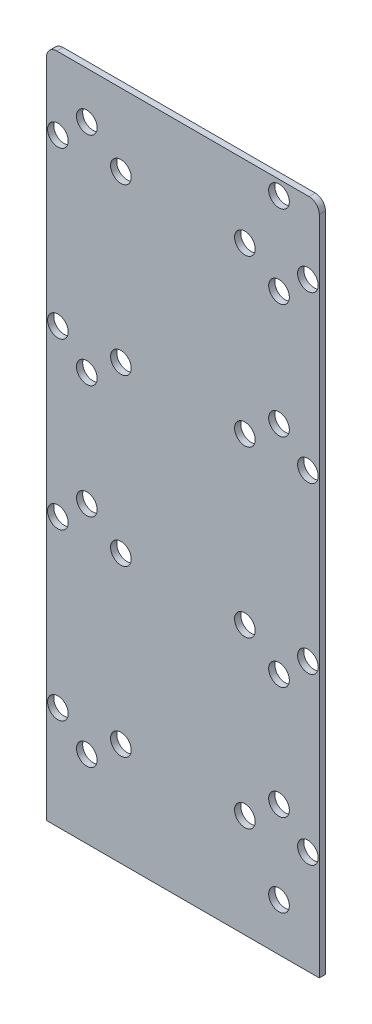
from build123d import *

# Parameters (mm, degrees)
SKETCH1_W           = 132
SKETCH1_H           = 325
BOSS_EXTRUDE1_DEPTH = 3
SKETCH2_R           = 5
CUT_EXTRUDE1_DEPTH  = 537.159285925
SKETCH3_R           = 5
CUT_EXTRUDE2_DEPTH  = 10
SKETCH4_R           = 5
CUT_EXTRUDE3_DEPTH  = 10
LPATTERN1_COUNT     = 4
LPATTERN1_PITCH     = 80
FILLET1_R           = 5


with BuildPart() as part:
    # Sketch1 → Boss-Extrude1 (new body)
    with BuildSketch(Plane.XY.offset(3)):
        with Locations((24.851179955, 365.89742901)):
            Rectangle(SKETCH1_W, SKETCH1_H)
    extrude(amount=-BOSS_EXTRUDE1_DEPTH)

    # Sketch2 → Cut-Extrude1 (cut, through all)
    with BuildSketch(Plane.XY.offset(3)):
        with Locations((71.351179955, 521.39742901)):
            Circle(SKETCH2_R)
        with Locations((71.351179955, 481.39742901)):
            Circle(SKETCH2_R)
        with Locations((71.351179955, 425.89742901)):
            Circle(SKETCH2_R)
        with Locations((71.351179955, 320.89742901)):
            Circle(SKETCH2_R)
        with Locations((71.351179955, 266.39742901)):
            Circle(SKETCH2_R)
        with Locations((71.351179955, 226.39742901)):
            Circle(SKETCH2_R)
    extrude(amount=-CUT_EXTRUDE1_DEPTH, mode=Mode.SUBTRACT)

    # Sketch3 → Cut-Extrude2 (cut)
    with BuildSketch(Plane.XY.offset(3)):
        with Locations((-21.648820045, 505.89742901)):
            Circle(SKETCH3_R)
        with Locations((-21.648820045, 400.89742901)):
            Circle(SKETCH3_R)
        with Locations((-21.648820045, 345.89742901)):
            Circle(SKETCH3_R)
        with Locations((-21.648820045, 240.89742901)):
            Circle(SKETCH3_R)
    extrude(amount=-CUT_EXTRUDE2_DEPTH, mode=Mode.SUBTRACT)

    # Sketch4 → Cut-Extrude3 (cut)
    with BuildSketch(Plane.XY.offset(3)):
        with Locations((-35.648820045, 253.39742901)):
            Circle(SKETCH4_R)
        with Locations((-5.148820045, 253.39742901)):
            Circle(SKETCH4_R)
        with Locations((54.851179955, 253.39742901)):
            Circle(SKETCH4_R)
        with Locations((85.351179955, 253.39742901)):
            Circle(SKETCH4_R)
    cut_extrude3 = extrude(amount=-CUT_EXTRUDE3_DEPTH, mode=Mode.SUBTRACT)

    # LPattern1: Cut-Extrude3 ×4
    with Locations(*[(0, i * LPATTERN1_PITCH, 0) for i in range(1, LPATTERN1_COUNT)]):
        add(cut_extrude3, mode=Mode.SUBTRACT)

    # Fillet1
    fillet1_edges = [part.edges().sort_by_distance(p)[0] for p in [
        (90.851179955, 528.39742901, 1.5),
        (-41.148820045, 528.39742901, 1.5),
    ]]
    fillet(fillet1_edges, radius=FILLET1_R)


solid = part.part
